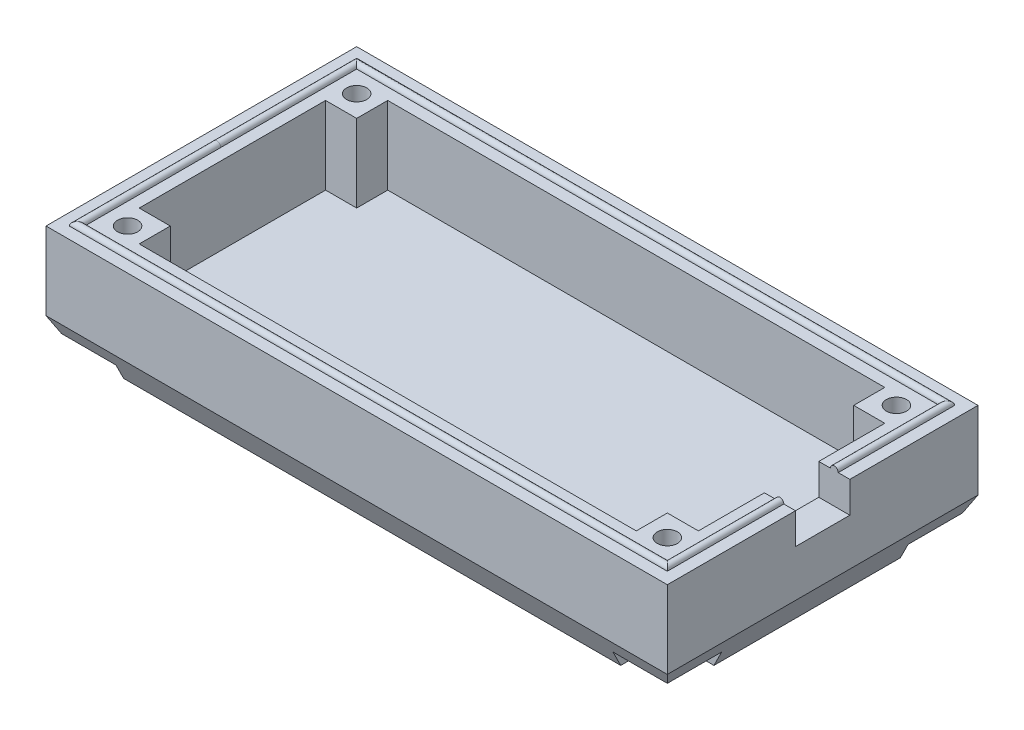
from build123d import *

# Parameters (mm, degrees)
SCHIZZO1_W                     = 40
SCHIZZO1_H                     = 20
ESTRUSIONE_ESTRUSIONE1_DEPTH   = 7
TAGLIO_ESTRUSIONE1_DEPTH       = 5
SMUSSO1_SIZE                   = 1
SMUSSO1_SIZE2                  = 2
SCHIZZO5_W                     = 4
SCHIZZO5_H                     = 4
TAGLIO_ESTRUSIONE2_DEPTH       = 1
FORO_PER_VITE_M1_1_D           = 1.3
FORO_PER_VITE_M1_1_CSINK_D     = 1.35
FORO_PER_VITE_M1_1_CSINK_ANGLE = 90
SPECCHIA2_COPY_1_D             = 1.3
SPECCHIA2_COPY_1_CSINK_D       = 1.35
SPECCHIA2_COPY_1_CSINK_ANGLE   = 90
SPECCHIA2_COPY_2_D             = 1.3
SPECCHIA2_COPY_2_CSINK_D       = 1.35
SPECCHIA2_COPY_2_CSINK_ANGLE   = 90
TAGLIO_ESTRUSIONE3_DEPTH       = 42.821047333
TAGLIO_ESTRUSIONE3_DEPTH_BACK  = 3
SCHIZZO8_W                     = 3.5
SCHIZZO8_H                     = 4


with BuildPart() as part:
    # Schizzo1 → Estrusione-Estrusione1 (new body)
    with BuildSketch(Plane(origin=(0, 0, 0), x_dir=(1, 0, 0), z_dir=(0, 1, 0))):
        Rectangle(SCHIZZO1_W, SCHIZZO1_H)
    extrude(amount=-ESTRUSIONE_ESTRUSIONE1_DEPTH)

    # Schizzo2 → Taglio-Estrusione1 (cut)
    with BuildSketch(Plane(origin=(0, 0, 0), x_dir=(1, 0, 0), z_dir=(0, 1, 0))):
        Polygon((-16, 8), (16, 8), (16, 6), (18, 6), (18, -6), (16, -6), (16, -8), (-16, -8), (-16, -6), (-18, -6), (-18, 6), (-16, 6), align=None)
    extrude(amount=-TAGLIO_ESTRUSIONE1_DEPTH, mode=Mode.SUBTRACT)

    # Sweep1: sweep along a path in Schizzo4
    with BuildLine(Plane(origin=(0, 0, 0), x_dir=(1, 0, 0), z_dir=(0, 1, 0))) as sweep1_path:
        Line((19, -9), (-19, -9))
        Line((-19, -9), (-19, 9))
        Line((-19, 9), (19, 9))
        Line((19, 9), (19, -9))
    # Schizzo3 → Sweep1 (sweep)
    with BuildSketch(Plane.XY):
        with BuildLine():
            Line((-18.75, 0), (-19.25, 0))
            ThreePointArc((-19.25, 0), (-19, 0.25), (-18.75, 0))
        make_face()
    sweep(path=sweep1_path.line, transition=Transition.RIGHT)

    # Smusso1
    smusso1_edges = [part.edges().sort_by_distance(p)[0] for p in [
        (0, -7, 10),
        (20, -7, 0),
        (0, -7, -10),
        (-20, -7, 0),
    ]]
    smusso1_side = [part.faces().sort_by_distance(p)[0] for p in [
        (0, -7, 0),
    ]]
    chamfer(smusso1_edges, length=SMUSSO1_SIZE, length2=SMUSSO1_SIZE2, reference=smusso1_side[0])

    # Schizzo5 → Taglio-Estrusione2 (cut)
    with BuildSketch(Plane.XZ.offset(7)):
        with Locations((-18, 8)):
            Rectangle(SCHIZZO5_W, SCHIZZO5_H)
        with Locations((18, 8)):
            Rectangle(SCHIZZO5_W, SCHIZZO5_H)
        with Locations((18, -8)):
            Rectangle(SCHIZZO5_W, SCHIZZO5_H)
        with Locations((-18, -8)):
            Rectangle(SCHIZZO5_W, SCHIZZO5_H)
    extrude(amount=-TAGLIO_ESTRUSIONE2_DEPTH, mode=Mode.SUBTRACT)

    # Foro per Vite M1-1 (through all)
    with Locations(Plane(origin=(0, -6, 0), x_dir=(-1, 0, 0), z_dir=(0, -1, 0))):
        with Locations((-17.375, 7.375)):
            foro_per_vite_m1_1 = CounterSinkHole(FORO_PER_VITE_M1_1_D / 2, FORO_PER_VITE_M1_1_CSINK_D / 2, counter_sink_angle=FORO_PER_VITE_M1_1_CSINK_ANGLE)

    # Specchia1: Foro per Vite M1-1 across plane
    add(foro_per_vite_m1_1.mirror(Plane(origin=(0, 0, 0), x_dir=(0, 0, 1), z_dir=(1, 0, 0))), mode=Mode.SUBTRACT)

    # Specchia2 copy 1 (through all)
    with Locations(Plane.XZ.offset(6)):
        with Locations((-17.375, 7.375)):
            CounterSinkHole(SPECCHIA2_COPY_1_D / 2, SPECCHIA2_COPY_1_CSINK_D / 2, counter_sink_angle=SPECCHIA2_COPY_1_CSINK_ANGLE)

    # Specchia2 copy 2 (through all)
    with Locations(Plane(origin=(0, -6, 0), x_dir=(-1, 0, 0), z_dir=(0, -1, 0))):
        with Locations((-17.375, -7.375)):
            CounterSinkHole(SPECCHIA2_COPY_2_D / 2, SPECCHIA2_COPY_2_CSINK_D / 2, counter_sink_angle=SPECCHIA2_COPY_2_CSINK_ANGLE)

    # Schizzo8 → Taglio-Estrusione3 (cut, two sides: drawn at the far end of the back side and taken through both)
    with BuildSketch(Plane(origin=(20, 0, 0), x_dir=(0, 0, -1), z_dir=(1, 0, 0)).offset(-TAGLIO_ESTRUSIONE3_DEPTH_BACK)):
        Rectangle(SCHIZZO8_W, SCHIZZO8_H)
    extrude(amount=TAGLIO_ESTRUSIONE3_DEPTH + TAGLIO_ESTRUSIONE3_DEPTH_BACK, mode=Mode.SUBTRACT)


solid = part.part
